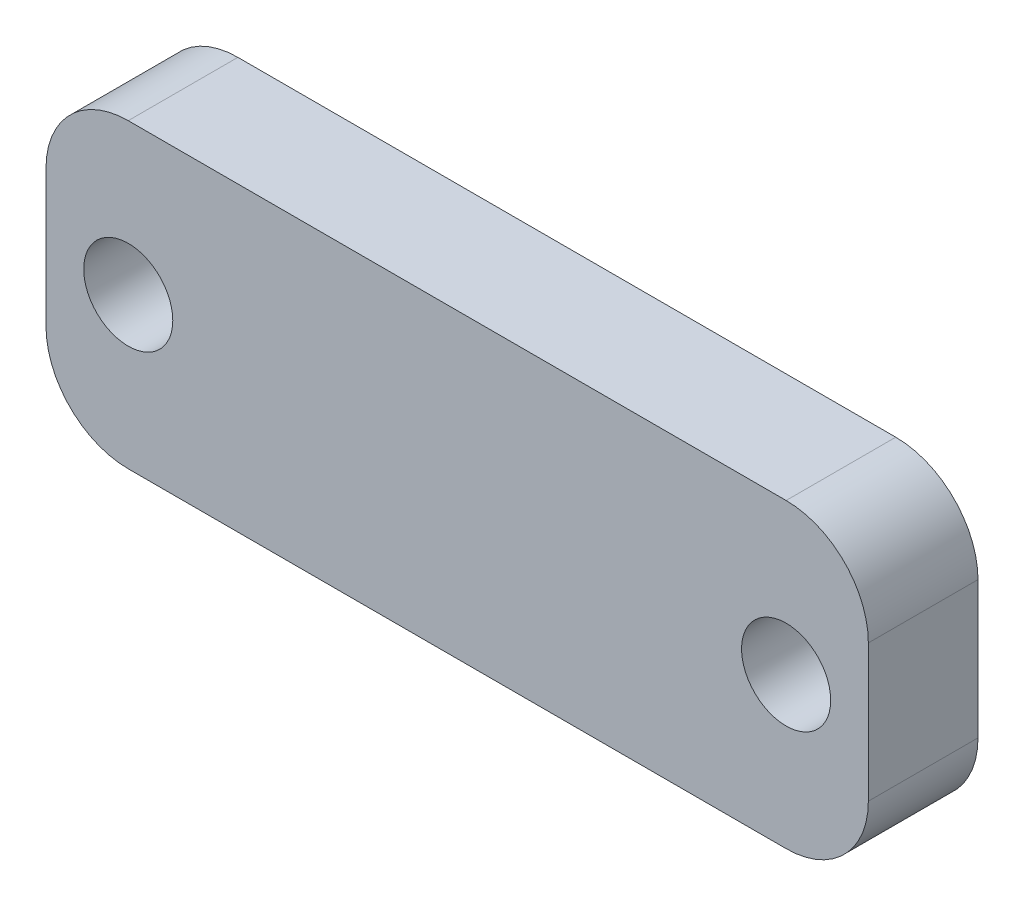
from build123d import *

# Parameters (mm, degrees)
SKETCH1_W                        = 95.25
SKETCH1_H                        = 34.925
BASE_FLANGE1_DEPTH               = 12.7
SKETCH2_R                        = 12.827
CUT_EXTRUDE1_DEPTH               = 4.7625
F_13_32_0_40625_DIAMETER_HOLE1_D = 10.31875
CHAMFER1_SIZE                    = 1.5875
FILLET1_R                        = 9.525


# Sheet-metal steps are written as plain solids
with BuildPart() as part:
    # Sketch1 → Base-Flange1 (new body)
    with BuildSketch(Plane.XY):
        Rectangle(SKETCH1_W, SKETCH1_H)
    extrude(amount=BASE_FLANGE1_DEPTH)

    # Sketch2 → Cut-Extrude1 (cut)
    with BuildSketch(Plane.XY):
        with Locations(Location((0, 0, 0), (0, 0, 180))):
            Circle(SKETCH2_R)
    extrude(amount=CUT_EXTRUDE1_DEPTH, mode=Mode.SUBTRACT)

    # 13/32 (0.40625) Diameter Hole1 (through all)
    with Locations(Plane.XY.offset(12.7)):
        with Locations((38.1, 0), (-38.1, 0)):
            Hole(F_13_32_0_40625_DIAMETER_HOLE1_D / 2)

    # Chamfer1
    chamfer1_edges = [part.edges().sort_by_distance(p)[0] for p in [
        (12.827, 0, 0),
    ]]
    chamfer(chamfer1_edges, length=CHAMFER1_SIZE)

    # Fillet1
    fillet1_edges = [part.edges().sort_by_distance(p)[0] for p in [
        (-47.625, 17.4625, 6.35),
        (47.625, 17.4625, 6.35),
        (47.625, -17.4625, 6.35),
        (-47.625, -17.4625, 6.35),
    ]]
    fillet(fillet1_edges, radius=FILLET1_R)


solid = part.part
